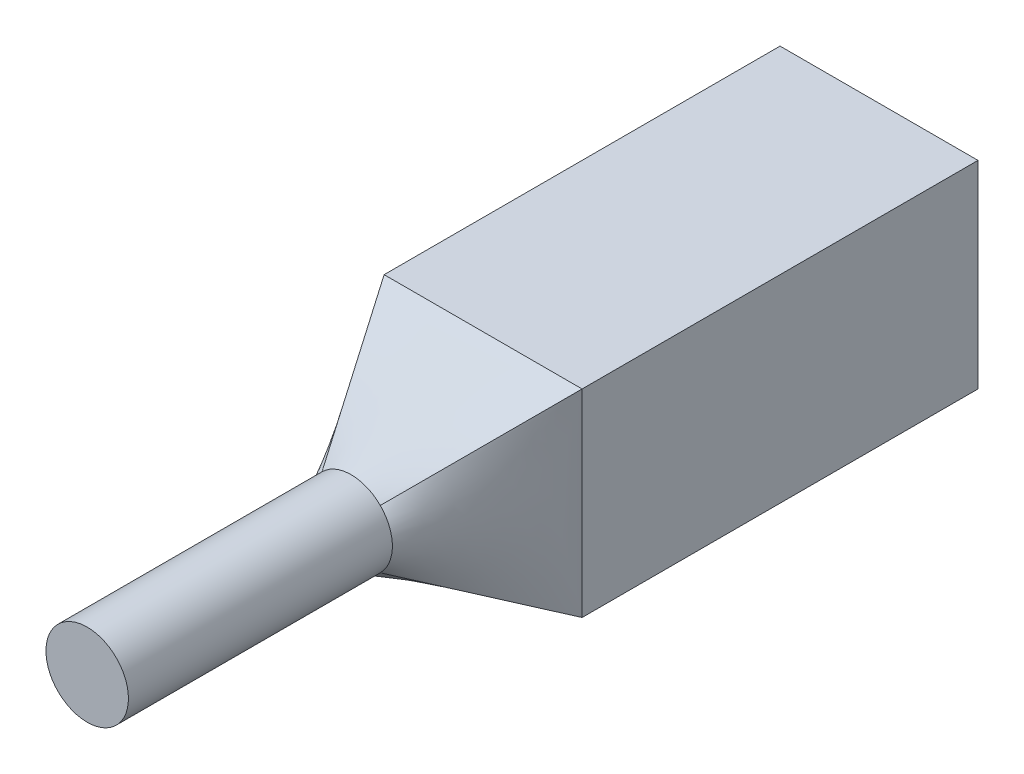
from build123d import *

# Parameters (mm, degrees)
SKETCH1_W           = 19.05
SKETCH1_H           = 19.05
BOSS_EXTRUDE1_DEPTH = 38.1
SKETCH3_3_R         = 3.96875
BOSS_EXTRUDE3_DEPTH = 25.4


with BuildPart() as part:
    # Sketch1 → Boss-Extrude1 (new body)
    with BuildSketch(Plane.XY):
        with Locations((9.525, 9.525)):
            Rectangle(SKETCH1_W, SKETCH1_H)
    extrude(amount=BOSS_EXTRUDE1_DEPTH)

    # Loft3: read off the stored shape, not the designer's step
    # Loft3: loft between two sections, ruled curve by curve
    loft3_from = [
        Edge.make_bspline([(12.331330038, 12.331330038, 50.8), (12.662059205, 12.000600871, 50.8), (12.958598179, 11.583509037, 50.8), (13.375977978, 10.619086159, 50.8), (13.49375, 10.072970025, 50.8), (13.49375, 8.977029975, 50.8), (13.375977978, 8.430913841, 50.8), (12.958598179, 7.466490963, 50.8), (12.662059205, 7.049399129, 50.8), (12.331330038, 6.718669962, 50.8)], [0, 0, 0, 0, 0.25, 0.25, 0.5, 0.5, 0.75, 0.75, 1, 1, 1, 1], 3),
        Edge.make_bspline([(12.331330038, 6.718669962, 50.8), (12.000600871, 6.387940795, 50.8), (11.583509037, 6.091401821, 50.8), (10.619086159, 5.674022022, 50.8), (10.072970025, 5.55625, 50.8), (8.977029975, 5.55625, 50.8), (8.430913841, 5.674022022, 50.8), (7.466490963, 6.091401821, 50.8), (7.049399129, 6.387940795, 50.8), (6.718669962, 6.718669962, 50.8)], [0, 0, 0, 0, 0.25, 0.25, 0.5, 0.5, 0.75, 0.75, 1, 1, 1, 1], 3),
        Edge.make_bspline([(6.718669962, 12.331330038, 50.8), (7.049399129, 12.662059205, 50.8), (7.466490963, 12.958598179, 50.8), (8.430913841, 13.375977978, 50.8), (8.977029975, 13.49375, 50.8), (10.072970025, 13.49375, 50.8), (10.619086159, 13.375977978, 50.8), (11.583509037, 12.958598179, 50.8), (12.000600871, 12.662059205, 50.8), (12.331330038, 12.331330038, 50.8)], [0, 0, 0, 0, 0.25, 0.25, 0.5, 0.5, 0.75, 0.75, 1, 1, 1, 1], 3),
        Edge.make_bspline([(6.718669962, 6.718669962, 50.8), (6.387940795, 7.049399129, 50.8), (6.091401821, 7.466490963, 50.8), (5.674022022, 8.430913841, 50.8), (5.55625, 8.977029975, 50.8), (5.55625, 10.072970025, 50.8), (5.674022022, 10.619086159, 50.8), (6.091401821, 11.583509037, 50.8), (6.387940795, 12.000600871, 50.8), (6.718669962, 12.331330038, 50.8)], [0, 0, 0, 0, 0.25, 0.25, 0.5, 0.5, 0.75, 0.75, 1, 1, 1, 1], 3),
    ]
    loft3_to = [
        Edge.make_bspline([(19.05, 19.05, 38.1), (19.05, 17.4625, 38.1), (19.05, 15.875, 38.1), (19.05, 12.7, 38.1), (19.05, 11.1125, 38.1), (19.05, 7.9375, 38.1), (19.05, 6.35, 38.1), (19.05, 3.175, 38.1), (19.05, 1.5875, 38.1), (19.05, 0, 38.1)], [0, 0, 0, 0, 0.25, 0.25, 0.5, 0.5, 0.75, 0.75, 1, 1, 1, 1], 3),
        Edge.make_bspline([(19.05, 0, 38.1), (17.4625, 0, 38.1), (15.875, 0, 38.1), (12.7, 0, 38.1), (11.1125, 0, 38.1), (7.9375, 0, 38.1), (6.35, 0, 38.1), (3.175, 0, 38.1), (1.5875, 0, 38.1), (0, 0, 38.1)], [0, 0, 0, 0, 0.25, 0.25, 0.5, 0.5, 0.75, 0.75, 1, 1, 1, 1], 3),
        Edge.make_bspline([(0, 19.05, 38.1), (1.5875, 19.05, 38.1), (3.175, 19.05, 38.1), (6.35, 19.05, 38.1), (7.9375, 19.05, 38.1), (11.1125, 19.05, 38.1), (12.7, 19.05, 38.1), (15.875, 19.05, 38.1), (17.4625, 19.05, 38.1), (19.05, 19.05, 38.1)], [0, 0, 0, 0, 0.25, 0.25, 0.5, 0.5, 0.75, 0.75, 1, 1, 1, 1], 3),
        Edge.make_bspline([(0, 0, 38.1), (0, 1.5875, 38.1), (0, 3.175, 38.1), (0, 6.35, 38.1), (0, 7.9375, 38.1), (0, 11.1125, 38.1), (0, 12.7, 38.1), (0, 15.875, 38.1), (0, 17.4625, 38.1), (0, 19.05, 38.1)], [0, 0, 0, 0, 0.25, 0.25, 0.5, 0.5, 0.75, 0.75, 1, 1, 1, 1], 3),
    ]
    loft3 = Solid(Shell([*[Face.make_surface_from_curves(loft3_from[k], loft3_to[k]) for k in range(4)], Face(Wire(loft3_from)), Face(Wire(loft3_to))]))
    add(loft3)

    # Sketch3<3> → Boss-Extrude3 (add)
    with BuildSketch(Plane.XY.offset(50.8)):
        with Locations(Location((9.525, 9.525, 0), (0, 0, 135))):
            Circle(SKETCH3_3_R)
    extrude(amount=BOSS_EXTRUDE3_DEPTH)


solid = part.part
